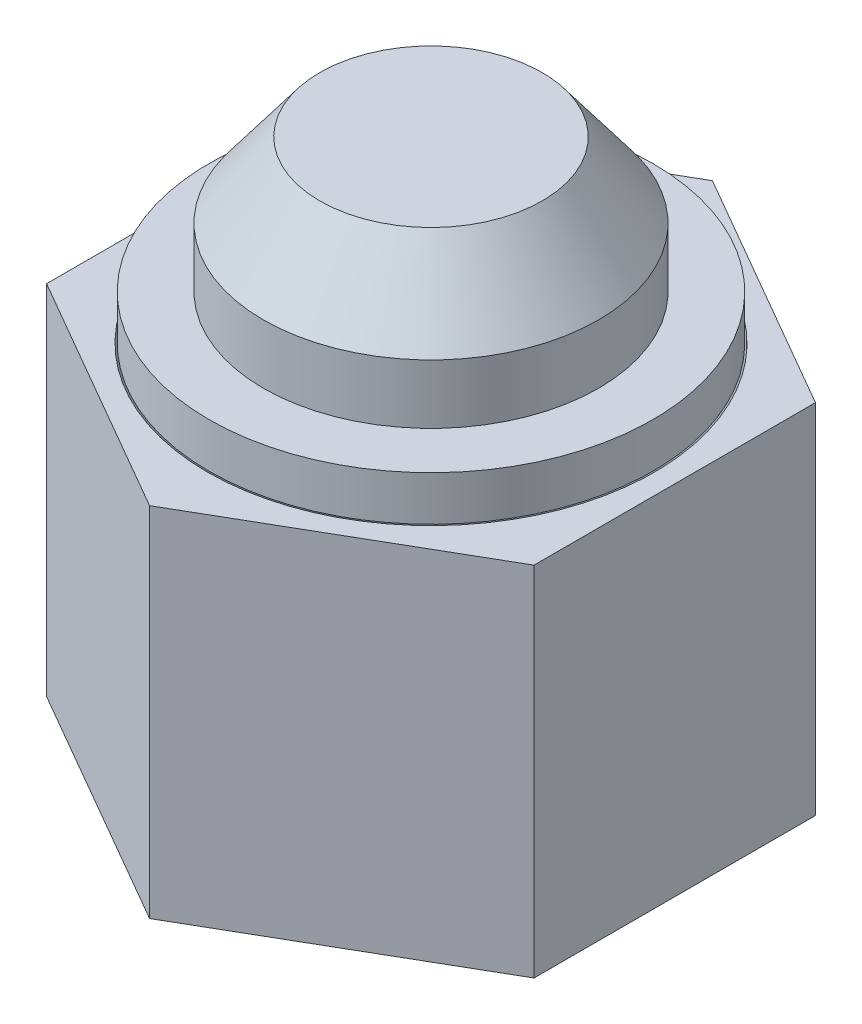
from build123d import *

# Parameters (mm, degrees)
SKETCH1_R           = 4.7625
BOSS_EXTRUDE1_DEPTH = 5.08
SKETCH1_4_R         = 6.35
BOSS_EXTRUDE4_DEPTH = 10.16
SKETCH7_R           = 6.304229739
BOSS_EXTRUDE5_DEPTH = 1.27
CHAMFER1_SIZE       = 2.126000066
CHAMFER1_SIZE2      = 1.60205596


with BuildPart() as part:
    # Sketch1 → Boss-Extrude1 (new body)
    with BuildSketch(Plane(origin=(0, 0, 0), x_dir=(1, 0, 0), z_dir=(0, 1, 0))):
        Circle(SKETCH1_R)
    extrude(amount=BOSS_EXTRUDE1_DEPTH)

    # Sketch7 → Boss-Extrude5 (add)
    with BuildSketch(Plane(origin=(0, 0, 0), x_dir=(1, 0, 0), z_dir=(0, 1, 0))):
        Circle(SKETCH7_R)
    extrude(amount=BOSS_EXTRUDE5_DEPTH)

    # Chamfer1
    chamfer1_edges = [part.edges().sort_by_distance(p)[0] for p in [
        (-4.7625, 5.08, 0),
    ]]
    chamfer1_side = [part.faces().sort_by_distance(p)[0] for p in [
        (-4.7625, 3.175, 0),
    ]]
    chamfer(chamfer1_edges, length=CHAMFER1_SIZE, length2=CHAMFER1_SIZE2, reference=chamfer1_side[0])


with BuildPart() as body_2:
    # Sketch1<4> → Boss-Extrude4 (new body)
    with BuildSketch(Plane(origin=(0, 0, 0), x_dir=(1, 0, 0), z_dir=(0, 1, 0))):
        Polygon((6.925488061, 3.998432396), (0, 7.996864793), (-6.925488061, 3.998432396), (-6.925488061, -3.998432396), (0, -7.996864793), (6.925488061, -3.998432396), align=None)
        Circle(SKETCH1_4_R, mode=Mode.SUBTRACT)
    extrude(amount=-BOSS_EXTRUDE4_DEPTH)


solid = Compound([part.part, body_2.part])
